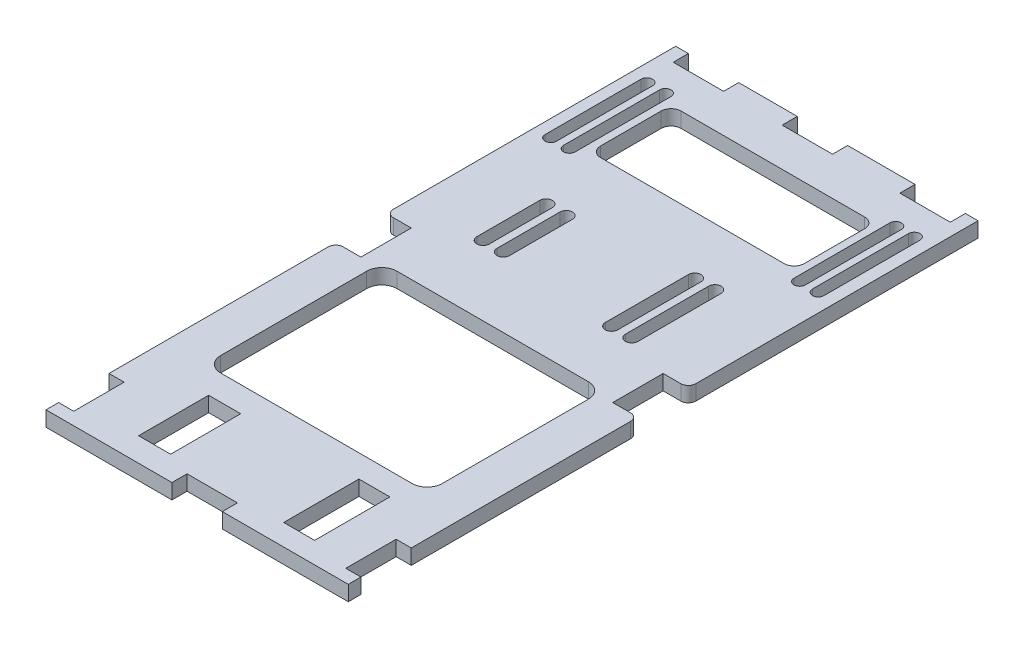
from build123d import *

# Parameters (mm, degrees)
CROQUIS1_W              = 6.149922685
CROQUIS1_H              = 14.93552652
CROQUIS1_W_2            = 6.357227068
CROQUIS1_H_2            = 13.910539406
SALIENTE_EXTRUIR1_DEPTH = 3


with BuildPart() as part:
    # Croquis1 → Saliente-Extruir1 (new body)
    with BuildSketch(Plane(origin=(0, 0, 0), x_dir=(1, 0, 0), z_dir=(0, 1, 0))):
        with BuildLine():
            Line((-30, 62.5), (-27.5, 62.5))
            Line((-27.5, 62.5), (-27.5, 59.5))
            Line((-27.5, 59.5), (-17.5, 59.5))
            Line((-17.5, 59.5), (-17.5, 62.5))
            Line((-17.5, 62.5), (-5.876016753, 62.5))
            Line((-5.876016753, 62.5), (-5.876016753, 59.5))
            Line((-5.876016753, 59.5), (4.123983247, 59.5))
            Line((4.123983247, 59.5), (4.123983247, 62.5))
            Line((4.123983247, 62.5), (17.5, 62.5))
            Line((17.5, 62.5), (17.5, 59.5))
            Line((17.5, 59.5), (27.5, 59.5))
            Line((27.5, 59.5), (27.5, 62.5))
            Line((27.5, 62.5), (30, 62.5))
            Line((30, 62.5), (30, 6.5))
            ThreePointArc((30, 6.5), (29.560660172, 5.439339828), (28.5, 5))
            Line((28.5, 5), (25, 5))
            Line((25, 5), (25, -5))
            Line((25, -5), (28.5, -5))
            ThreePointArc((28.5, -5), (29.560660172, -5.439339828), (30, -6.5))
            Line((30, -6.5), (30, -50))
            Line((30, -50), (27, -50))
            Line((27, -50), (27, -60))
            Line((27, -60), (30, -60))
            Line((30, -60), (30, -62.5))
            Line((30, -62.5), (5, -62.5))
            Line((5, -62.5), (5, -59.5))
            Line((5, -59.5), (-5, -59.5))
            Line((-5, -59.5), (-5, -62.5))
            Line((-5, -62.5), (-30, -62.5))
            Line((-30, -62.5), (-30, -60))
            Line((-30, -60), (-27, -60))
            Line((-27, -60), (-27, -50))
            Line((-27, -50), (-30, -50))
            Line((-30, -50), (-30, -6.5))
            ThreePointArc((-30, -6.5), (-29.560660172, -5.439339828), (-28.5, -5))
            Line((-28.5, -5), (-25, -5))
            Line((-25, -5), (-25, 5))
            Line((-25, 5), (-28.5, 5))
            ThreePointArc((-28.5, 5), (-29.560660172, 5.439339828), (-30, 6.5))
            Line((-30, 6.5), (-30, 62.5))
        make_face()
        with Locations((16.033519219, -50.810195139)):
            Rectangle(CROQUIS1_W, CROQUIS1_H, mode=Mode.SUBTRACT)
        with Locations((-13.178613534, -50.810195139)):
            Rectangle(CROQUIS1_W_2, CROQUIS1_H_2, mode=Mode.SUBTRACT)
        with BuildLine():
            Line((23.903, 34.344181633), (23.903, 53.394181633))
            ThreePointArc((23.903, 53.394181633), (22.76, 54.537181633), (21.617, 53.394181633))
            Line((21.617, 53.394181633), (21.617, 34.344181633))
            ThreePointArc((21.617, 34.344181633), (22.76, 33.201181633), (23.903, 34.344181633))
        make_face(mode=Mode.SUBTRACT)
        with BuildLine():
            Line((-21.817, 34.344181633), (-21.817, 53.394181633))
            ThreePointArc((-21.817, 53.394181633), (-22.96, 54.537181633), (-24.103, 53.394181633))
            Line((-24.103, 53.394181633), (-24.103, 34.344181633))
            ThreePointArc((-24.103, 34.344181633), (-22.96, 33.201181633), (-21.817, 34.344181633))
        make_face(mode=Mode.SUBTRACT)
        with BuildLine():
            Line((27.586, 34.344181633), (27.586, 53.394181633))
            ThreePointArc((27.586, 53.394181633), (26.443, 54.537181633), (25.3, 53.394181633))
            Line((25.3, 53.394181633), (25.3, 34.344181633))
            ThreePointArc((25.3, 34.344181633), (26.443, 33.201181633), (27.586, 34.344181633))
        make_face(mode=Mode.SUBTRACT)
        with BuildLine():
            Line((-25.5, 34.344181633), (-25.5, 53.394181633))
            ThreePointArc((-25.5, 53.394181633), (-26.643, 54.537181633), (-27.786, 53.394181633))
            Line((-27.786, 53.394181633), (-27.786, 34.344181633))
            ThreePointArc((-27.786, 34.344181633), (-26.643, 33.201181633), (-25.5, 34.344181633))
        make_face(mode=Mode.SUBTRACT)
        with BuildLine():
            Line((-10.5, 10.01183749), (-10.5, 22.51183749))
            ThreePointArc((-10.5, 22.51183749), (-11.75, 23.76183749), (-13, 22.51183749))
            Line((-13, 22.51183749), (-13, 10.01183749))
            ThreePointArc((-13, 10.01183749), (-11.75, 8.76183749), (-10.5, 10.01183749))
        make_face(mode=Mode.SUBTRACT)
        with BuildLine():
            Line((22, -35.834842383), (22, -6.834842383))
            ThreePointArc((22, -6.834842383), (21.121320344, -4.71352204), (19, -3.834842383))
            Line((19, -3.834842383), (-19, -3.834842383))
            ThreePointArc((-19, -3.834842383), (-21.121320344, -4.71352204), (-22, -6.834842383))
            Line((-22, -6.834842383), (-22, -35.834842383))
            ThreePointArc((-22, -35.834842383), (-21.121320344, -37.956162727), (-19, -38.834842383))
            Line((-19, -38.834842383), (19, -38.834842383))
            ThreePointArc((19, -38.834842383), (21.121320344, -37.956162727), (22, -35.834842383))
        make_face(mode=Mode.SUBTRACT)
        with BuildLine():
            Line((13, 8.01183749), (13, 24.51183749))
            ThreePointArc((13, 24.51183749), (11.75, 25.76183749), (10.5, 24.51183749))
            Line((10.5, 24.51183749), (10.5, 8.01183749))
            ThreePointArc((10.5, 8.01183749), (11.75, 6.76183749), (13, 8.01183749))
        make_face(mode=Mode.SUBTRACT)
        with BuildLine():
            Line((-14.5, 10.01183749), (-14.5, 22.51183749))
            ThreePointArc((-14.5, 22.51183749), (-15.75, 23.76183749), (-17, 22.51183749))
            Line((-17, 22.51183749), (-17, 10.01183749))
            ThreePointArc((-17, 10.01183749), (-15.75, 8.76183749), (-14.5, 10.01183749))
        make_face(mode=Mode.SUBTRACT)
        with BuildLine():
            Line((17, 8.01183749), (17, 24.51183749))
            ThreePointArc((17, 24.51183749), (15.75, 25.76183749), (14.5, 24.51183749))
            Line((14.5, 24.51183749), (14.5, 8.01183749))
            ThreePointArc((14.5, 8.01183749), (15.75, 6.76183749), (17, 8.01183749))
        make_face(mode=Mode.SUBTRACT)
        with BuildLine():
            Line((-20.317, 49.894181633), (-20.317, 37.894181633))
            ThreePointArc((-20.317, 37.894181633), (-19.731213562, 36.47996807), (-18.317, 35.894181633))
            Line((-18.317, 35.894181633), (18.117, 35.894181633))
            ThreePointArc((18.117, 35.894181633), (19.531213562, 36.47996807), (20.117, 37.894181633))
            Line((20.117, 37.894181633), (20.117, 49.894181633))
            ThreePointArc((20.117, 49.894181633), (19.531213562, 51.308395195), (18.117, 51.894181633))
            Line((18.117, 51.894181633), (-13.317, 51.894181633))
            Line((-13.317, 51.894181633), (-18.317, 51.894181633))
            ThreePointArc((-18.317, 51.894181633), (-19.731213562, 51.308395195), (-20.317, 49.894181633))
        make_face(mode=Mode.SUBTRACT)
    extrude(amount=SALIENTE_EXTRUIR1_DEPTH)


solid = part.part
